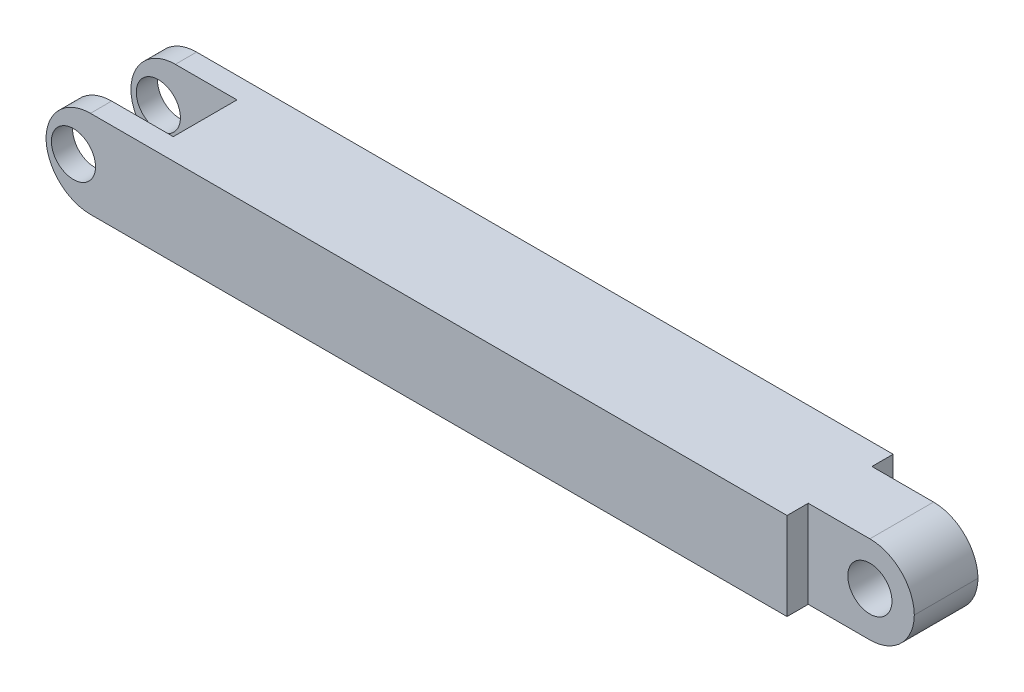
from build123d import *

# Parameters (mm, degrees)
BOSS_EXTRUDE1_DEPTH = 8.255
FILLET1_R           = 4.191
SKETCH2_R           = 2.07899
CUT_EXTRUDE1_DEPTH  = 81.896006892
FILLET2_R           = 4.191
SKETCH3_R           = 2.07899
CUT_EXTRUDE2_DEPTH  = 8.255


with BuildPart() as part:
    # Sketch1 → Boss-Extrude1 (new body)
    with BuildSketch(Plane(origin=(0, 0, 0), x_dir=(1, 0, 0), z_dir=(0, 1, 0))):
        Polygon((69.85, -8.001), (69.85, -9.99998), (0, -9.99998), (0, -8.001), (9.99998, -8.001), (9.99998, -1.99898), (0, -1.99898), (0, 0), (69.85, 0), (69.85, -1.99898), (79.84998, -1.99898), (79.84998, -8.001), align=None)
    extrude(amount=BOSS_EXTRUDE1_DEPTH)

    # Fillet1
    # the kernel refuses this fillet: 4.191 mm, written as the material it takes off along each edge
    with BuildSketch(Plane(origin=(0, 0, 12.47648), x_dir=(0, 1, 0), z_dir=(0, 0, -1)), Plane(origin=(0, 0, 20.47748), x_dir=(0, 1, 0), z_dir=(0, 0, -1))) as fillet1_piece_1:
        with BuildLine():
            CenterArc((FILLET1_R, FILLET1_R), FILLET1_R, 180, 90)
            Line((0, FILLET1_R), (0, 0))
            Line((0, 0), (FILLET1_R, 0))
        make_face()
    extrude(amount=22.95398, mode=Mode.SUBTRACT)
    with BuildSketch(Plane(origin=(0, 8.255, 12.47648), x_dir=(0, -1, 0), z_dir=(0, 0, -1)), Plane(origin=(0, 8.255, 20.47748), x_dir=(0, -1, 0), z_dir=(0, 0, -1))) as fillet1_piece_2:
        with BuildLine():
            CenterArc((FILLET1_R, -FILLET1_R), FILLET1_R, 90, 90)
            Line((0, -FILLET1_R), (0, 0))
            Line((0, 0), (FILLET1_R, 0))
        make_face()
    extrude(amount=22.95398, mode=Mode.SUBTRACT)

    # Sketch2 → Cut-Extrude1 (cut, through all)
    with BuildSketch(Plane.XY.offset(9.99998)):
        with Locations((2.587471088, 4.1275)):
            Circle(SKETCH2_R)
    extrude(amount=-CUT_EXTRUDE1_DEPTH, mode=Mode.SUBTRACT)

    # Fillet2
    # the kernel refuses this fillet: 4.191 mm, written as the material it takes off along each edge
    with BuildSketch(Plane(origin=(79.84998, 0, -8.47852), x_dir=(-1, 0, 0), z_dir=(0, 0, 1))) as fillet2_piece_1:
        with BuildLine():
            CenterArc((FILLET2_R, -FILLET2_R), FILLET2_R, 90, 90)
            Line((0, -FILLET2_R), (0, 0))
            Line((0, 0), (FILLET2_R, 0))
        make_face()
    extrude(amount=26.95702, mode=Mode.SUBTRACT)
    with BuildSketch(Plane(origin=(79.84998, 8.255, -8.47852), x_dir=(-1, 0, 0), z_dir=(0, 0, 1))) as fillet2_piece_2:
        with BuildLine():
            CenterArc((FILLET2_R, FILLET2_R), FILLET2_R, 180, 90)
            Line((0, FILLET2_R), (0, 0))
            Line((0, 0), (FILLET2_R, 0))
        make_face()
    extrude(amount=26.95702, mode=Mode.SUBTRACT)

    # Sketch3 → Cut-Extrude2 (cut)
    with BuildSketch(Plane.XY.offset(8.001)):
        with Locations((75.65898, 4.191)):
            Circle(SKETCH3_R)
    extrude(amount=-CUT_EXTRUDE2_DEPTH, mode=Mode.SUBTRACT)


solid = part.part
